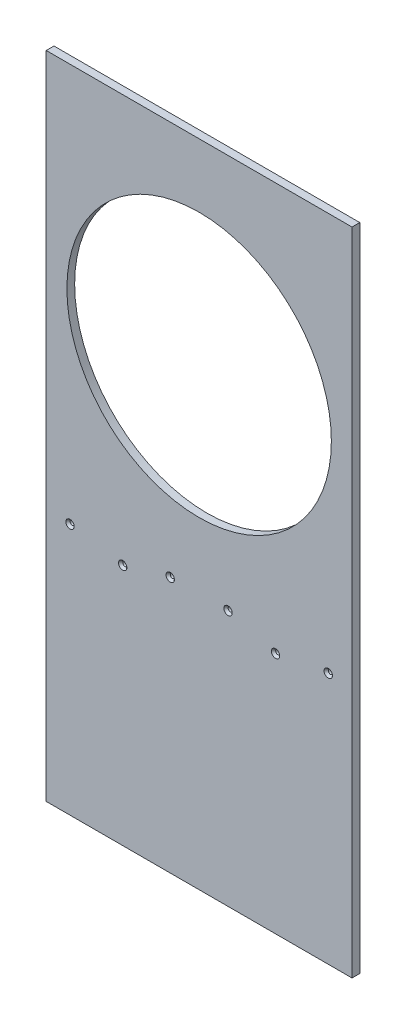
from build123d import *

# Parameters (mm, degrees)
SKETCH1_W                                        = 469.9
SKETCH1_H                                        = 999.49
SKETCH1_R                                        = 203.2
BOSS_EXTRUDE1_DEPTH                              = 11.90625
CSK_FOR_1_4_FLAT_HEAD_MACHINE_SCREW1_D           = 6.7564
CSK_FOR_1_4_FLAT_HEAD_MACHINE_SCREW1_CSINK_D     = 12.8778
CSK_FOR_1_4_FLAT_HEAD_MACHINE_SCREW1_CSINK_ANGLE = 82


with BuildPart() as part:
    # Sketch1 → Boss-Extrude1 (new body)
    with BuildSketch(Plane.XY):
        with Locations((52.469932717, -499.745)):
            Rectangle(SKETCH1_W, SKETCH1_H)
        with Locations((52.469932717, -300.99)):
            Circle(SKETCH1_R, mode=Mode.SUBTRACT)
    extrude(amount=BOSS_EXTRUDE1_DEPTH)

    # CSK for 1/4 Flat Head Machine Screw1 (through all)
    with Locations(Plane.XY.offset(11.90625)):
        with Locations((-145.967567283, -612.14), (-65.005067283, -626.4275), (8.019932717, -605.79), (96.919932717, -605.79), (169.944932717, -626.4275), (250.907432717, -612.14)):
            CounterSinkHole(CSK_FOR_1_4_FLAT_HEAD_MACHINE_SCREW1_D / 2, CSK_FOR_1_4_FLAT_HEAD_MACHINE_SCREW1_CSINK_D / 2, counter_sink_angle=CSK_FOR_1_4_FLAT_HEAD_MACHINE_SCREW1_CSINK_ANGLE)


solid = part.part
